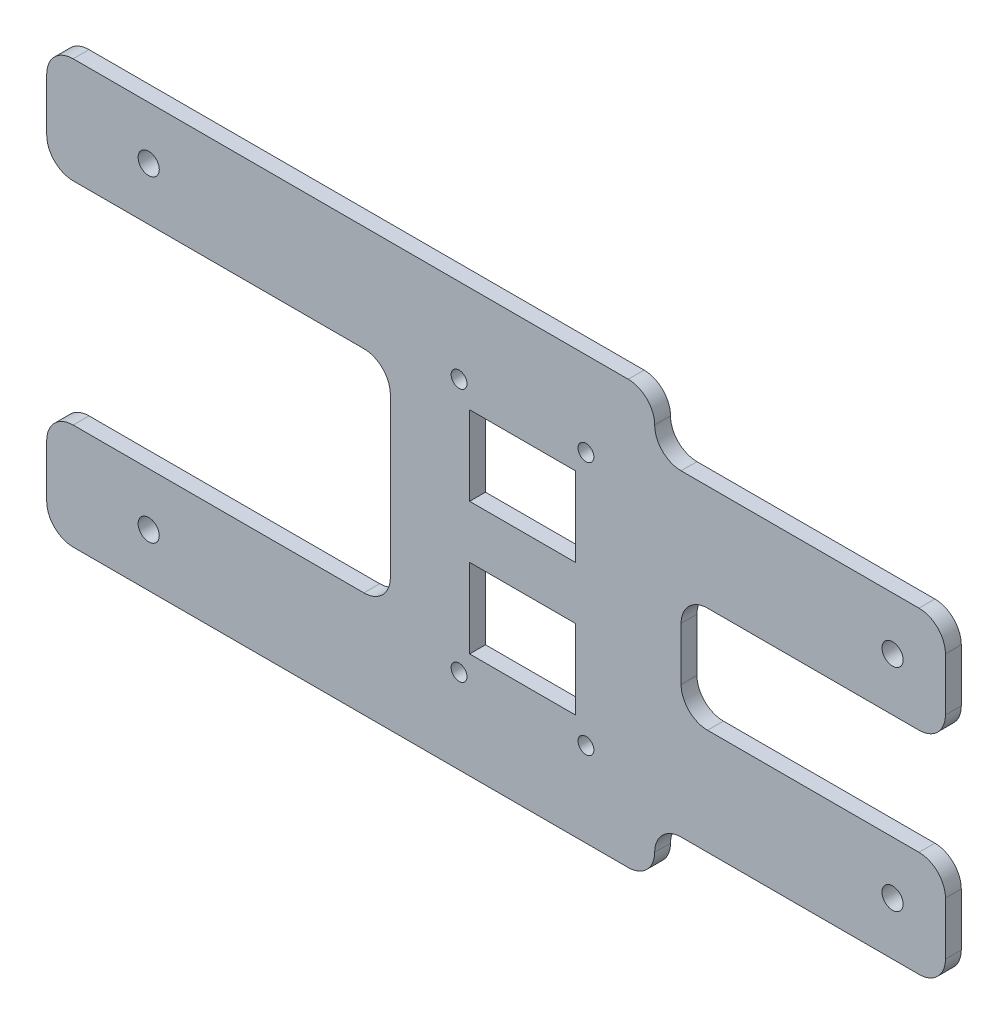
from build123d import *

# Parameters (mm, degrees)
CROQUIS18_R             = 2
CROQUIS18_R_2           = 1.5
CROQUIS18_W             = 20
CROQUIS18_H             = 15
SALIENTE_EXTRUIR1_DEPTH = 3
REDONDEO1_R             = 5


with BuildPart() as part:
    # Croquis18 → Saliente-Extruir1 (new body)
    with BuildSketch(Plane.XY):
        Polygon((-90, -40), (25, -40), (25, -30), (80, -30), (80, -10), (30, -10), (30, 10), (80, 10), (80, 30), (25, 30), (25, 40), (-90, 40), (-90, 20), (-25, 20), (-25, -20), (-90, -20), align=None)
        with Locations((-70.71, -30)):
            Circle(CROQUIS18_R, mode=Mode.SUBTRACT)
        with Locations((-12, -24)):
            Circle(CROQUIS18_R_2, mode=Mode.SUBTRACT)
        with Locations((12, -24)):
            Circle(CROQUIS18_R_2, mode=Mode.SUBTRACT)
        with Locations((70, -20)):
            Circle(CROQUIS18_R, mode=Mode.SUBTRACT)
        with Locations((0, -12.5)):
            Rectangle(CROQUIS18_W, CROQUIS18_H, mode=Mode.SUBTRACT)
        with Locations((-70.71, 30)):
            Circle(CROQUIS18_R, mode=Mode.SUBTRACT)
        with Locations((-12, 24)):
            Circle(CROQUIS18_R_2, mode=Mode.SUBTRACT)
        with Locations((0, 12.5)):
            Rectangle(CROQUIS18_W, CROQUIS18_H, mode=Mode.SUBTRACT)
        with Locations((70, 20)):
            Circle(CROQUIS18_R, mode=Mode.SUBTRACT)
        with Locations((12, 24)):
            Circle(CROQUIS18_R_2, mode=Mode.SUBTRACT)
    extrude(amount=SALIENTE_EXTRUIR1_DEPTH)

    # Redondeo1
    redondeo1_edges = [part.edges().sort_by_distance(p)[0] for p in [
        (25, -40, 1.5),
        (25, -30, 1.5),
        (25, 40, 1.5),
        (25, 30, 1.5),
        (-25, -20, 1.5),
        (-25, 20, 1.5),
        (-90, -40, 1.5),
        (-90, -20, 1.5),
        (-90, 20, 1.5),
        (-90, 40, 1.5),
        (80, 30, 1.5),
        (80, -30, 1.5),
        (30, -10, 1.5),
        (30, 10, 1.5),
        (80, -10, 1.5),
        (80, 10, 1.5),
    ]]
    fillet(redondeo1_edges, radius=REDONDEO1_R - 0.0001)  # a hair under: the kernel refuses the full size


solid = part.part
